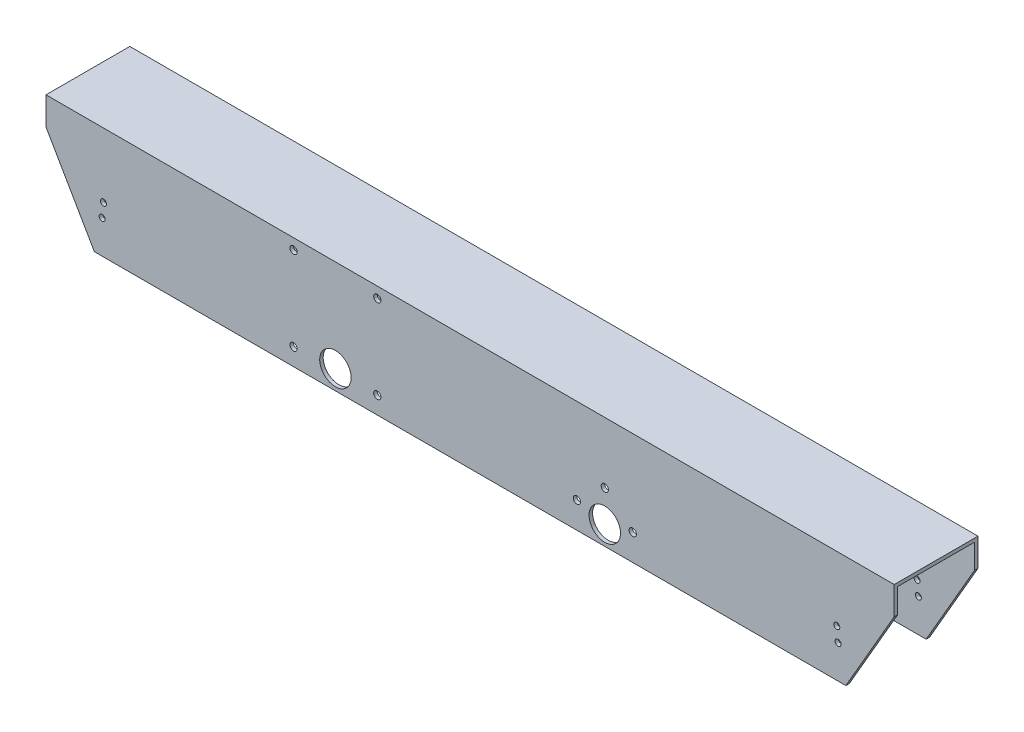
from build123d import *

# Parameters (mm, degrees)
BOSS_EXTRUDE1_DEPTH                     = 385.705756272
BEVELED_ENDS_DEPTH                      = 101.6
SKETCH2_R                               = 2.749999961
SKETCH2_R_2                             = 14.2875
SKETCH2_R_3                             = 2.75
SKETCH2_R_4                             = 3.302
AXLES_DEPTH                             = 141.732
FLANIGAN_MOUNTING_HOLES_R               = 3.3
FLANIGAN_MOUNTING_HOLES_EXTRUSION_DEPTH = 397.429073633


with BuildPart() as part:
    # Sketch1 → Boss-Extrude1 (new, symmetric)
    with BuildSketch(Plane(origin=(0, 0, 0), x_dir=(0, 0, -1), z_dir=(1, 0, 0))):
        Polygon((-38.1, 50.8), (38.1, 50.8), (38.1, -50.8), (34.925, -50.8), (34.925, 47.625), (-34.925, 47.625), (-34.925, -50.8), (-38.1, -50.8), align=None)
    extrude(amount=BOSS_EXTRUDE1_DEPTH, both=True)

    # Sketch16 → Beveled ends (cut)
    with BuildSketch(Plane.XY.offset(38.1)):
        Polygon((-385.705756272, 25.4), (-341.71166576, -50.8), (-385.705756272, -50.8), align=None)
        Polygon((341.71166576, -50.8), (385.705756272, -50.8), (385.705756272, 25.4), align=None)
    extrude(amount=-BEVELED_ENDS_DEPTH, mode=Mode.SUBTRACT)

    # Sketch2 → Axles (cut)
    with BuildSketch(Plane.XY.offset(38.1)):
        with Locations((-333.476515281, -7.874)):
            Circle(SKETCH2_R)
        with Locations((122.5, -33.274)):
            Circle(SKETCH2_R_2)
        with Locations((334.620154629, -20.574)):
            Circle(SKETCH2_R_3)
        with Locations((333.476515281, -7.874)):
            Circle(SKETCH2_R)
        with Locations((-160.6, -35.12)):
            Circle(SKETCH2_R_4)
        with Locations((-160.6, 41.08)):
            Circle(SKETCH2_R_4)
        with Locations((-122.5, -33.274)):
            Circle(SKETCH2_R_2)
        with Locations((-334.620154629, -20.574)):
            Circle(SKETCH2_R_3)
        with Locations((-84.4, 41.08)):
            Circle(SKETCH2_R_4)
        with Locations((-84.4, -35.12)):
            Circle(SKETCH2_R_4)
    extrude(amount=-AXLES_DEPTH, mode=Mode.SUBTRACT)

    # Flanigan mounting holes → Flanigan mounting holes extrusion (cut, through all)
    with BuildSketch(Plane.XY.offset(38.1)):
        with Locations((97.1, -26.924)):
            Circle(FLANIGAN_MOUNTING_HOLES_R)
        with Locations((122.5, -4.694)):
            Circle(FLANIGAN_MOUNTING_HOLES_R)
        with Locations((147.9, -26.924)):
            Circle(FLANIGAN_MOUNTING_HOLES_R)
    extrude(amount=-FLANIGAN_MOUNTING_HOLES_EXTRUSION_DEPTH, mode=Mode.SUBTRACT)


solid = part.part
